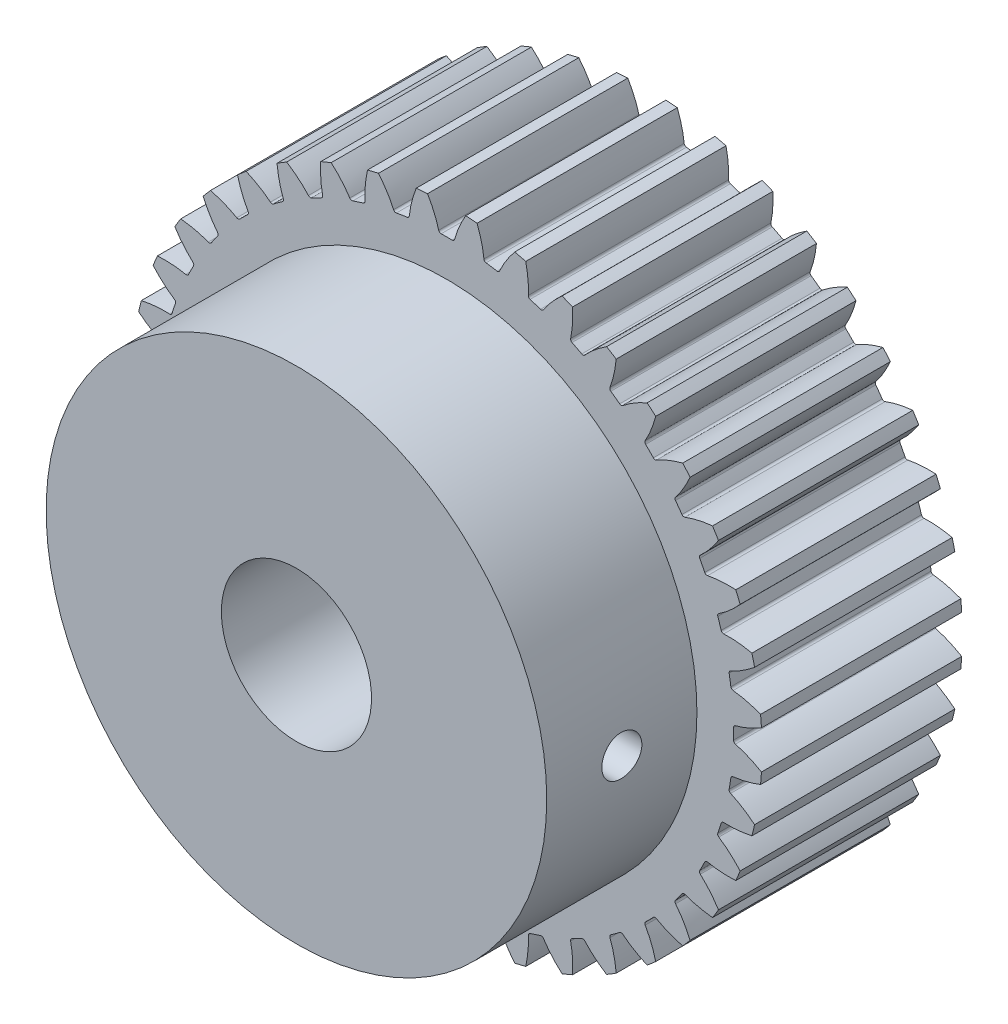
from build123d import *

# Parameters (mm, degrees)
SKETCH1_R                = 31.5
BOSS_EXTRUDE1_DEPTH      = 20
CUT_EXTRUDE2_DEPTH       = 49.831342394
FILLET1_R                = 0.25
CIRPATTERN1_COUNT        = 40
FILLET1_OF_CIRPATTERN1_R = 0.25
SKETCH1_8_R              = 25
BOSS_EXTRUDE2_DEPTH      = 35
SKETCH2_R                = 7.5
CUT_EXTRUDE4_DEPTH       = 57.588251431
CUT_EXTRUDE5_REACH       = 75.48
SKETCH3_R                = 2


with BuildPart() as part:
    # Sketch1 → Boss-Extrude1 (new body)
    with BuildSketch(Plane.XY):
        Circle(SKETCH1_R)
    extrude(amount=BOSS_EXTRUDE1_DEPTH)

    # Sketch1<5> → Cut-Extrude2 (cut, through all)
    with BuildSketch(Plane.XY):
        with BuildLine():
            add(Edge.make_bspline(
                [(-1.906543024, 31.442250137), (-1.695696445, 31.078842528), (-1.308431171, 30.336664954), (-0.941741922, 29.392730706), (-0.785074835, 28.820981083), (-0.748482141, 28.649753144)],
                knots=[0.31361624, 0.31361624, 0.31361624, 0.31361624, 0.385710722, 0.457140092, 0.487211711, 0.487211711, 0.487211711, 0.487211711], degree=3))
            ThreePointArc((-0.748482141, 28.649753144), (0, 28.65952862), (0.748482141, 28.649753144))
            add(Edge.make_bspline(
                [(1.906543024, 31.442250137), (1.695696445, 31.078842528), (1.308431171, 30.336664954), (0.941741922, 29.392730706), (0.785074835, 28.820981083), (0.748482141, 28.649753144)],
                knots=[0.31361624, 0.31361624, 0.31361624, 0.31361624, 0.385710722, 0.457140092, 0.487211711, 0.487211711, 0.487211711, 0.487211711], degree=3))
            ThreePointArc((1.906543024, 31.442250137), (0, 31.5), (-1.906543024, 31.442250137))
        make_face()
    cut_extrude2 = extrude(amount=CUT_EXTRUDE2_DEPTH, mode=Mode.SUBTRACT)

    # Fillet1
    fillet1_edges = [part.edges().sort_by_distance(p)[0] for p in [
        (0.748482141, 28.649753144, 10),
        (-0.748482141, 28.649753144, 10),
    ]]
    fillet(fillet1_edges, radius=FILLET1_R)

    # CirPattern1: Cut-Extrude2 ×40 about axis
    cirpattern1_axis = Axis((0, 0, 20), (0, 0, -1))
    for i in range(1, CIRPATTERN1_COUNT):
        add(cut_extrude2.rotate(cirpattern1_axis, i * 360 / CIRPATTERN1_COUNT), mode=Mode.SUBTRACT)

    # Fillet1 of CirPattern1
    fillet1_of_cirpattern1_edges = [part.edges().sort_by_distance(p)[0] for p in [
        (5.22107589, 28.179938738, 10),
        (3.742541723, 28.414115544, 10),
        (9.565109423, 27.016240716, 10),
        (8.141411789, 27.478828119, 10),
        (13.673618218, 25.187313187, 10),
        (12.339813277, 25.866920749, 10),
        (17.445437151, 22.738190414, 10),
        (16.234367608, 23.618083942, 10),
        (20.787691525, 19.72917793, 10),
        (19.72917793, 20.787691525, 10),
        (23.618083942, 16.234367608, 10),
        (22.738190414, 17.445437151, 10),
        (25.866920749, 12.339813277, 10),
        (25.187313187, 13.673618218, 10),
        (27.478828119, 8.141411789, 10),
        (27.016240716, 9.565109423, 10),
        (28.414115544, 3.742541723, 10),
        (28.179938738, 5.22107589, 10),
        (28.649753144, -0.748482141, 10),
        (28.649753144, 0.748482141, 10),
        (28.179938738, -5.22107589, 10),
        (28.414115544, -3.742541723, 10),
        (27.016240716, -9.565109423, 10),
        (27.478828119, -8.141411789, 10),
        (25.187313187, -13.673618218, 10),
        (25.866920749, -12.339813277, 10),
        (22.738190414, -17.445437151, 10),
        (23.618083942, -16.234367608, 10),
        (19.72917793, -20.787691525, 10),
        (20.787691525, -19.72917793, 10),
        (16.234367608, -23.618083942, 10),
        (17.445437151, -22.738190414, 10),
        (12.339813277, -25.866920749, 10),
        (13.673618218, -25.187313187, 10),
        (8.141411789, -27.478828119, 10),
        (9.565109423, -27.016240716, 10),
        (3.742541723, -28.414115544, 10),
        (5.22107589, -28.179938738, 10),
        (-0.748482141, -28.649753144, 10),
        (0.748482141, -28.649753144, 10),
        (-5.22107589, -28.179938738, 10),
        (-3.742541723, -28.414115544, 10),
        (-9.565109423, -27.016240716, 10),
        (-8.141411789, -27.478828119, 10),
        (-13.673618218, -25.187313187, 10),
        (-12.339813277, -25.866920749, 10),
        (-17.445437151, -22.738190414, 10),
        (-16.234367608, -23.618083942, 10),
        (-20.787691525, -19.72917793, 10),
        (-19.72917793, -20.787691525, 10),
        (-23.618083942, -16.234367608, 10),
        (-22.738190414, -17.445437151, 10),
        (-25.866920749, -12.339813277, 10),
        (-25.187313187, -13.673618218, 10),
        (-27.478828119, -8.141411789, 10),
        (-27.016240716, -9.565109423, 10),
        (-28.414115544, -3.742541723, 10),
        (-28.179938738, -5.22107589, 10),
        (-28.649753144, 0.748482141, 10),
        (-28.649753144, -0.748482141, 10),
        (-28.179938738, 5.22107589, 10),
        (-28.414115544, 3.742541723, 10),
        (-27.016240716, 9.565109423, 10),
        (-27.478828119, 8.141411789, 10),
        (-25.187313187, 13.673618218, 10),
        (-25.866920749, 12.339813277, 10),
        (-22.738190414, 17.445437151, 10),
        (-23.618083942, 16.234367608, 10),
        (-19.72917793, 20.787691525, 10),
        (-20.787691525, 19.72917793, 10),
        (-16.234367608, 23.618083942, 10),
        (-17.445437151, 22.738190414, 10),
        (-12.339813277, 25.866920749, 10),
        (-13.673618218, 25.187313187, 10),
        (-8.141411789, 27.478828119, 10),
        (-9.565109423, 27.016240716, 10),
        (-3.742541723, 28.414115544, 10),
        (-5.22107589, 28.179938738, 10),
    ]]
    fillet(fillet1_of_cirpattern1_edges, radius=FILLET1_OF_CIRPATTERN1_R)

    # Sketch1<8> → Boss-Extrude2 (add)
    with BuildSketch(Plane.XY):
        Circle(SKETCH1_8_R)
    extrude(amount=BOSS_EXTRUDE2_DEPTH)

    # Sketch2 → Cut-Extrude4 (cut, through all)
    with BuildSketch(Plane(origin=(0, 0, 0), x_dir=(-1, 0, 0), z_dir=(0, 0, -1))):
        Circle(SKETCH2_R)
    extrude(amount=-CUT_EXTRUDE4_DEPTH, mode=Mode.SUBTRACT)

    # Sketch3 → Cut-Extrude5 (cut, up to next)
    with BuildSketch(Plane(origin=(25, 0, 0), x_dir=(0, 0, -1), z_dir=(1, 0, 0)), mode=Mode.PRIVATE) as cut_extrude5_sk1:
        with Locations((-27.5, 0)):
            Circle(SKETCH3_R)
    cut_extrude5_tool1 = extrude(cut_extrude5_sk1.sketch, amount=-CUT_EXTRUDE5_REACH, mode=Mode.PRIVATE) & part.part
    add(cut_extrude5_tool1.solids().sort_by_distance((25, 0, 27.5))[0], mode=Mode.SUBTRACT)


solid = part.part
